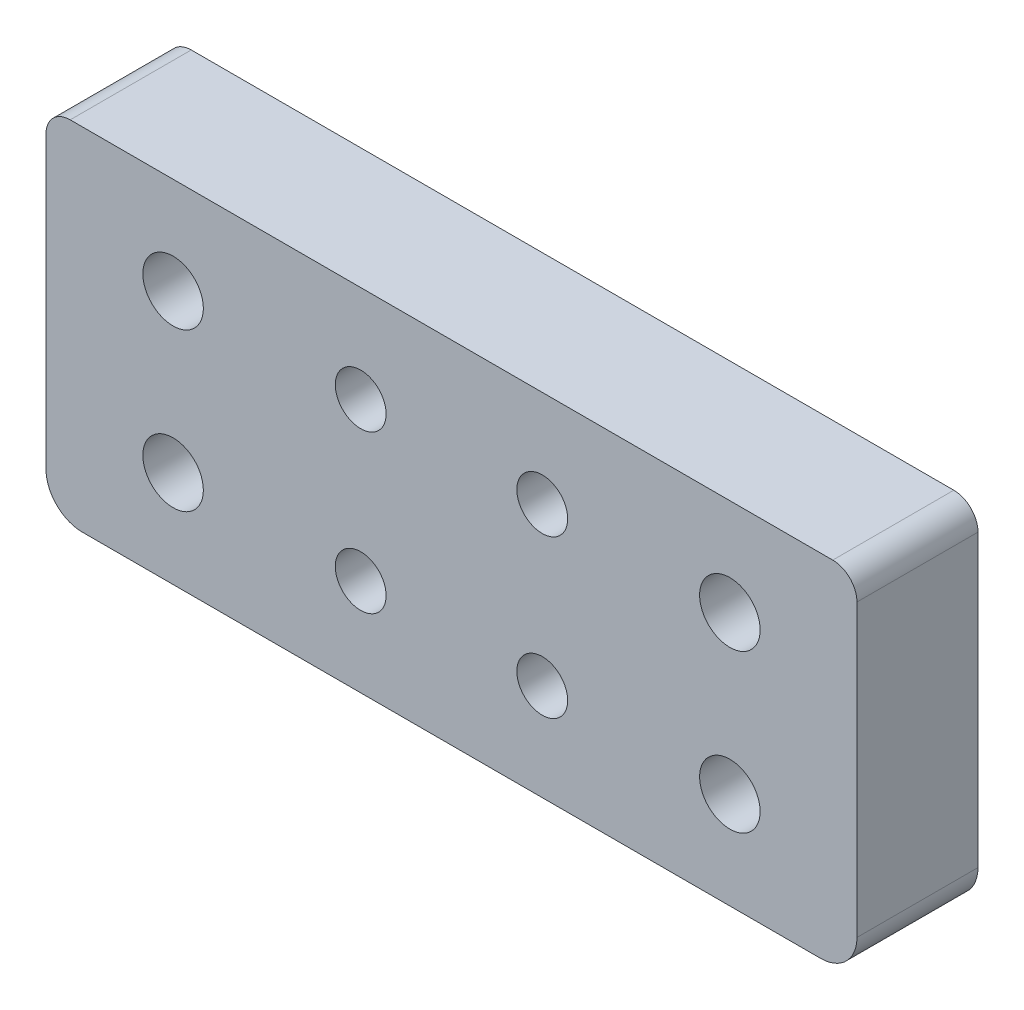
from build123d import *

# Parameters (mm, degrees)
SKETCH_1_W                  = 67
SKETCH_1_H                  = 16
EXTRUDE_1_DEPTH             = 10
HOLE_WIZARD_M5_1_AT_2_COUNT = 2
HOLE_WIZARD_M5_1_AT_2_PITCH = 15
HOLE_WIZARD_M6_1_AT_2_COUNT = 2
HOLE_WIZARD_M6_1_AT_2_PITCH = 46
FILLET_1_R                  = 2
SKETCH_8_W                  = 67
SKETCH_8_H                  = 10
EXTRUDE_2_DEPTH             = 13
DELETE_START                = -33.5
DELETE_FACE_1_OUTLINE_W     = 27
DELETE_FACE_1_OUTLINE_H     = 10
DELETE_FACE_1_DEPTH         = 2.5
DELETE_START_2              = 31
DELETE_FACE_2_OUTLINE_W     = 27
DELETE_FACE_2_OUTLINE_H     = 10
DELETE_FACE_2_DEPTH         = 2.5
FILLET_2_R                  = 3


with BuildPart() as part:
    # 草图1 → 凸台-拉伸1 (new body)
    with BuildSketch(Plane.XY):
        Rectangle(SKETCH_1_W, SKETCH_1_H)
    extrude(amount=EXTRUDE_1_DEPTH)

    # 草图4 → M5 螺纹孔1 (revolve, cut)
    with BuildSketch(Plane(origin=(-7.5, 0, 10), x_dir=(0, -1, 0), z_dir=(1, 0, 0))):
        Polygon((0, 0), (0, 13.6618073), (2.1, 12.4), (2.1, 0), align=None)
    hole_wizard_m5_1 = revolve(axis=Axis((-7.5, 0, 16.35), (0, 0, -1)), mode=Mode.SUBTRACT)

    # M5 螺纹孔1 at 2: M5 螺纹孔1 ×2
    with Locations(*[(i * HOLE_WIZARD_M5_1_AT_2_PITCH, 0, 0) for i in range(1, HOLE_WIZARD_M5_1_AT_2_COUNT)]):
        add(hole_wizard_m5_1, mode=Mode.SUBTRACT)

    # 草图7 → M6 螺纹孔1 (revolve, cut)
    with BuildSketch(Plane(origin=(-23, 0, 10), x_dir=(0, -1, 0), z_dir=(1, 0, 0))):
        Polygon((0, 0), (0, 16.502151548), (2.5, 15), (2.5, 0), align=None)
    hole_wizard_m6_1 = revolve(axis=Axis((-23, 0, 16.35), (0, 0, -1)), mode=Mode.SUBTRACT)

    # M6 螺纹孔1 at 2: M6 螺纹孔1 ×2
    with Locations(*[(i * HOLE_WIZARD_M6_1_AT_2_PITCH, 0, 0) for i in range(1, HOLE_WIZARD_M6_1_AT_2_COUNT)]):
        add(hole_wizard_m6_1, mode=Mode.SUBTRACT)

    # 圆角1
    fillet_1_edges = [part.edges().sort_by_distance(p)[0] for p in [
        (33.5, -8, 5),
        (-33.5, -8, 5),
        (-33.5, 8, 5),
        (33.5, 8, 5),
    ]]
    fillet(fillet_1_edges, radius=FILLET_1_R)

    # 草图8 → 凸台-拉伸2 (add)
    with BuildSketch(Plane.XZ.offset(8)):
        with Locations((0, 5)):
            Rectangle(SKETCH_8_W, SKETCH_8_H)
    extrude(amount=EXTRUDE_2_DEPTH)

    # Delete Face 1: read off the stored shape, not the designer's step
    # Delete Face 1 outline → Delete Face 1 (add)
    with BuildSketch(Plane.YZ.offset(DELETE_START)):
        with Locations((-7.5, 5)):
            Rectangle(DELETE_FACE_1_OUTLINE_W, DELETE_FACE_1_OUTLINE_H)
    extrude(amount=DELETE_FACE_1_DEPTH)

    # Delete Face 2: read off the stored shape, not the designer's step
    # Delete Face 2 outline → Delete Face 2 (add)
    with BuildSketch(Plane.YZ.offset(DELETE_START_2)):
        with Locations((-7.5, 5)):
            Rectangle(DELETE_FACE_2_OUTLINE_W, DELETE_FACE_2_OUTLINE_H)
    extrude(amount=DELETE_FACE_2_DEPTH)

    # 镜向1: M5 螺纹孔1, M6 螺纹孔1 across plane
    add(hole_wizard_m5_1.mirror(Plane(origin=(0, -6.5, 0), x_dir=(0, 0, 1), z_dir=(0, -1, 0))), mode=Mode.SUBTRACT)
    add(hole_wizard_m6_1.mirror(Plane(origin=(0, -6.5, 0), x_dir=(0, 0, 1), z_dir=(0, -1, 0))), mode=Mode.SUBTRACT)

    # 镜向1 copy 1 sketch → 镜向1 copy 1 (revolve, cut)
    with BuildSketch(Plane(origin=(7.5, -13, 10), x_dir=(0, 1, 0), z_dir=(1, 0, 0))):
        Polygon((0, 0), (0, -13.6618073), (2.1, -12.4), (2.1, 0), align=None)
    revolve(axis=Axis((7.5, -13, 16.35), (0, 0, 1)), mode=Mode.SUBTRACT)

    # 镜向1 copy 2 sketch → 镜向1 copy 2 (revolve, cut)
    with BuildSketch(Plane(origin=(23, -13, 10), x_dir=(0, 1, 0), z_dir=(1, 0, 0))):
        Polygon((0, 0), (0, -16.502151548), (2.5, -15), (2.5, 0), align=None)
    revolve(axis=Axis((23, -13, 16.35), (0, 0, 1)), mode=Mode.SUBTRACT)

    # 圆角2
    fillet_2_edges = [part.edges().sort_by_distance(p)[0] for p in [
        (-33.5, -21, 5),
        (33.5, -21, 5),
    ]]
    fillet(fillet_2_edges, radius=FILLET_2_R)


solid = part.part
